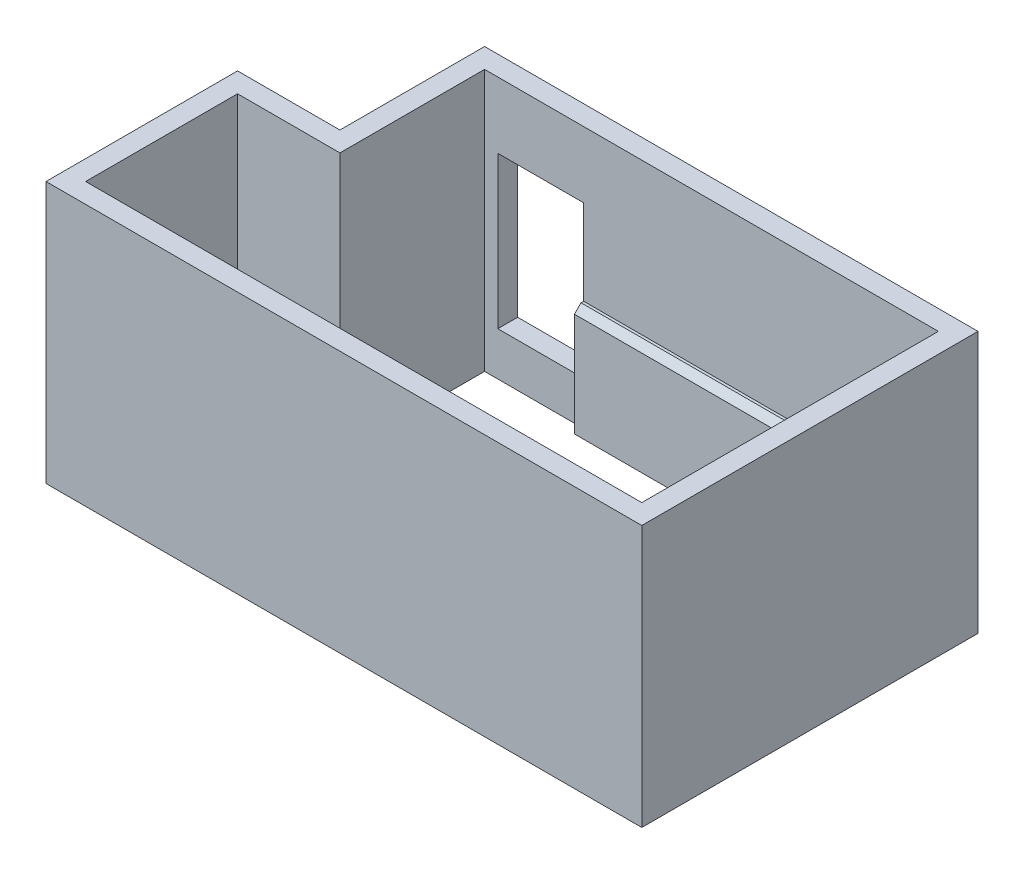
from build123d import *

# Parameters (mm, degrees)
SKETCH_1_W          = 6870
SKETCH_1_H          = 300
EXTRUDE_1_DEPTH     = 3960
SKETCH_3_W          = 1300
SKETCH_3_H          = 2300
CUT_EXTRUDE_1_DEPTH = 300
SKETCH_4_W          = 5370
SKETCH_4_H          = 1670
EXTRUDE_2_DEPTH     = 140
FILLET_START        = -84.347935733
FILLET_1_OUTLINE_W  = 5370
FILLET_1_OUTLINE_H  = 141.421356237
FILLET_1_DEPTH      = 71.347935733


with BuildPart() as part:
    # Эскиз1 → Бобышка-Вытянуть1 (new body)
    with BuildSketch(Plane(origin=(0, 0, 0), x_dir=(1, 0, 0), z_dir=(0, 1, 0))):
        Polygon((8076.35402749, -2660.714005328), (7776.35402749, -2660.714005328), (7776.35402749, 1829.285994672), (7776.35402749, 2129.285994672), (8076.35402749, 2129.285994672), align=None)
        with Locations((4341.35402749, 1979.285994672)):
            Rectangle(SKETCH_1_W, SKETCH_1_H)
        Polygon((-643.64597251, -2960.714005328), (-643.64597251, -2660.714005328), (7776.35402749, -2660.714005328), (8076.35402749, -2660.714005328), (8076.35402749, -2960.714005328), align=None)
        Polygon((-943.64597251, -360.714005328), (-643.64597251, -360.714005328), (-643.64597251, -2660.714005328), (-643.64597251, -2960.714005328), (-943.64597251, -2960.714005328), align=None)
        Polygon((-943.64597251, -60.714005328), (606.35402749, -60.714005328), (606.35402749, 2129.285994672), (906.35402749, 2129.285994672), (906.35402749, 1829.285994672), (906.35402749, -360.714005328), (-643.64597251, -360.714005328), (-943.64597251, -360.714005328), align=None)
    extrude(amount=EXTRUDE_1_DEPTH)

    # Эскиз3 → Вырез-Вытянуть1 (cut)
    with BuildSketch(Plane.XY.offset(-1829.285994672)):
        with Locations((1756.35402749, 1810)):
            Rectangle(SKETCH_3_W, SKETCH_3_H)
    extrude(amount=-CUT_EXTRUDE_1_DEPTH, mode=Mode.SUBTRACT)

    # Эскиз4 → Бобышка-Вытянуть2 (add)
    with BuildSketch(Plane.XY.offset(-1829.285994672)):
        with Locations((5091.35402749, 835)):
            Rectangle(SKETCH_4_W, SKETCH_4_H)
    extrude(amount=EXTRUDE_2_DEPTH)

    # Фаска1: read off the stored shape, not the designer's step
    # Фаска1 outline → Фаска1 (cut)
    with BuildSketch(Plane(origin=(0, 0, 0), x_dir=(1, 0, 0), z_dir=(0, 0.7071067811865476, 0.7071067811865476)).offset(FILLET_START)):
        with Locations((5091.35402749, 2375.373906778)):
            Rectangle(FILLET_1_OUTLINE_W, FILLET_1_OUTLINE_H)
    extrude(amount=FILLET_1_DEPTH, mode=Mode.SUBTRACT)


solid = part.part
